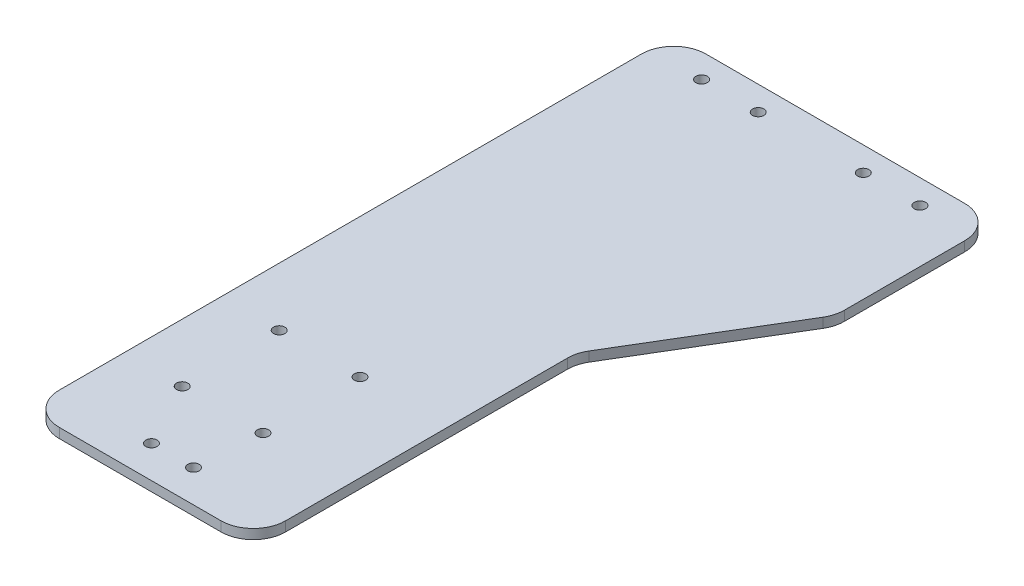
from build123d import *

# Parameters (mm, degrees)
SKETCH_1_W          = 100
SKETCH_1_H          = 200
EXTRUDE_1_DEPTH     = 3
CUT_EXTRUDE_1_DEPTH = 10
FILLET_2_R          = 10
SKETCH_4_R          = 1.75
CUT_EXTRUDE_2_DEPTH = 21
SKETCH_5_R          = 1.75
CUT_EXTRUDE_3_DEPTH = 4
SKETCH_7_R          = 1.75
CUT_EXTRUDE_4_DEPTH = 4


with BuildPart() as part:
    # 草图1 → 凸台-拉伸1 (new body)
    with BuildSketch(Plane(origin=(0, 0, 0), x_dir=(1, 0, 0), z_dir=(0, 1, 0))):
        Rectangle(SKETCH_1_W, SKETCH_1_H)
    extrude(amount=EXTRUDE_1_DEPTH)

    # 草图3 → 切除-拉伸1 (cut)
    with BuildSketch(Plane(origin=(0, 3, 0), x_dir=(1, 0, 0), z_dir=(0, 1, 0))):
        Polygon((20, -100), (20, 0), (50, 50), (50, -100), align=None)
    extrude(amount=-CUT_EXTRUDE_1_DEPTH, mode=Mode.SUBTRACT)

    # 圆角2
    fillet_2_edges = [part.edges().sort_by_distance(p)[0] for p in [
        (50, 1.5, -100),
        (-50, 1.5, -100),
        (-50, 1.5, 100),
        (20, 1.5, 100),
        (20, 1.5, 0),
        (50, 1.5, -50),
    ]]
    fillet(fillet_2_edges, radius=FILLET_2_R)

    # 草图4 → 切除-拉伸2 (cut)
    with BuildSketch(Plane(origin=(0, 3, 0), x_dir=(1, 0, 0), z_dir=(0, 1, 0))):
        with Locations((33.647397187, 92.5)):
            Circle(SKETCH_4_R)
        with Locations((16.132669012, 92.5)):
            Circle(SKETCH_4_R)
        with Locations((-33.867330988, 92.5)):
            Circle(SKETCH_4_R)
        with Locations((-16.352602813, 92.5)):
            Circle(SKETCH_4_R)
    extrude(amount=-CUT_EXTRUDE_2_DEPTH, mode=Mode.SUBTRACT)

    # 草图5 → 切除-拉伸3 (cut)
    with BuildSketch(Plane.XZ):
        with Locations((-8.5, 90)):
            Circle(SKETCH_5_R)
        with Locations((-21.5, 90)):
            Circle(SKETCH_5_R)
    extrude(amount=-CUT_EXTRUDE_3_DEPTH, mode=Mode.SUBTRACT)

    # 草图7 → 切除-拉伸4 (cut)
    with BuildSketch(Plane(origin=(0, 3, 0), x_dir=(1, 0, 0), z_dir=(0, 1, 0))):
        with Locations((-32, -40)):
            Circle(SKETCH_7_R)
        with Locations((-7, -40)):
            Circle(SKETCH_7_R)
        with Locations((-7, -70)):
            Circle(SKETCH_7_R)
        with Locations((-32, -70)):
            Circle(SKETCH_7_R)
    extrude(amount=-CUT_EXTRUDE_4_DEPTH, mode=Mode.SUBTRACT)


solid = part.part
